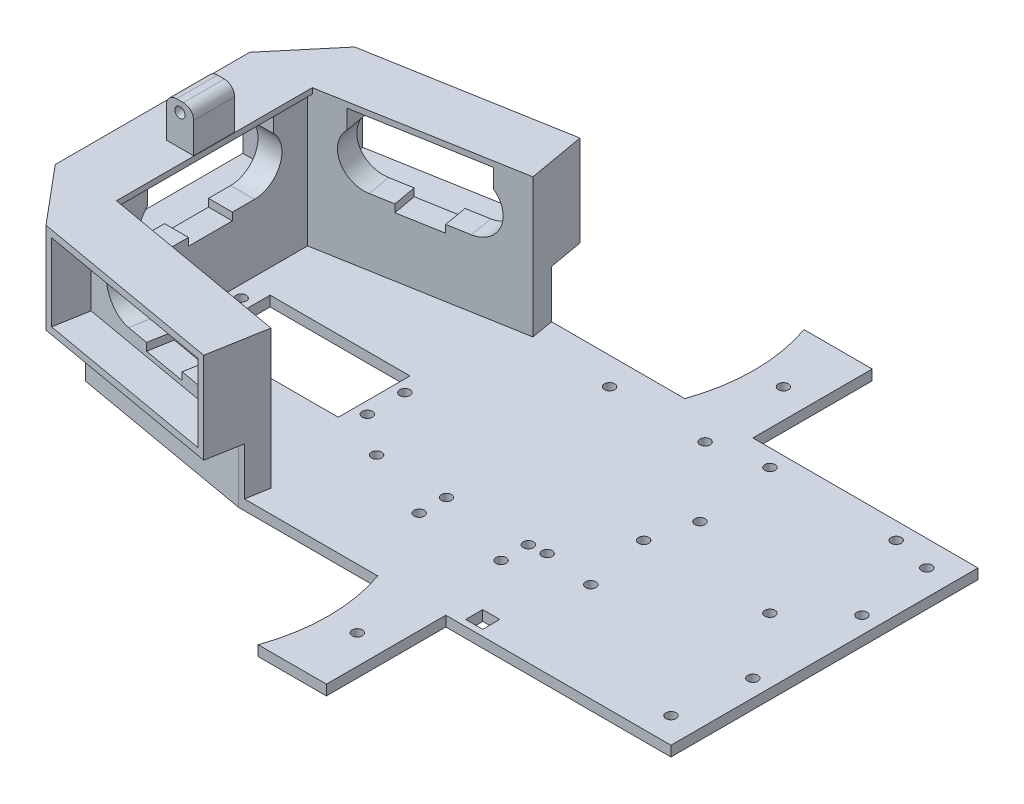
from build123d import *

# Parameters (mm, degrees)
CUT_EXTRUDE1_START         = -17
CUT_EXTRUDE1_DEPTH         = 17
CUT_EXTRUDE1_2_OUTLINE_R   = 1.5
CUT_EXTRUDE1_2_OUTLINE_W   = 5
CUT_EXTRUDE1_2_OUTLINE_H   = 5
CUT_EXTRUDE1_2_DEPTH       = 3
CUT_EXTRUDE2_DEPTH         = 223.538615307
SKETCH3_W                  = 57.527059783
SKETCH3_H                  = 57
CUT_EXTRUDE3_DEPTH         = 14
SKETCH4_R                  = 1.5
SKETCH4_W                  = 41
SKETCH4_H                  = 21
CUT_EXTRUDE4_DEPTH         = 223.329564617
SKETCH5_R                  = 1.5
BOSS_EXTRUDE1_DEPTH        = 3
SKETCH6_R                  = 1.5
CUT_EXTRUDE5_DEPTH         = 223.329564617
BOSS_EXTRUDE2_START        = 57.765161545
BOSS_EXTRUDE2_DEPTH        = 5.62
BOSS_EXTRUDE2_START_2      = 77.265161545
BOSS_EXTRUDE2_2_DEPTH      = 5.5
BOSS_EXTRUDE2_START_3      = 82.765161545
BOSS_EXTRUDE2_3_DEPTH      = 1.651
BOSS_EXTRUDE2_4_OUTLINE_W  = 7
BOSS_EXTRUDE2_4_OUTLINE_H  = 12.86
BOSS_EXTRUDE2_4_DEPTH      = 3.38
BOSS_EXTRUDE2_START_4      = 84.416161545
BOSS_EXTRUDE2_5_OUTLINE_W  = 8
BOSS_EXTRUDE2_5_OUTLINE_H  = 12
BOSS_EXTRUDE2_5_DEPTH      = 7.4999999
BOSS_EXTRUDE2_6_OUTLINE_W  = 1.082567319
BOSS_EXTRUDE2_6_OUTLINE_H  = 12
BOSS_EXTRUDE2_6_DEPTH      = 9
BOSS_EXTRUDE2_START_5      = 63.385161545
BOSS_EXTRUDE2_7_DEPTH      = 13.88
BOSS_EXTRUDE2_START_6      = 91.916161445
BOSS_EXTRUDE2_8_OUTLINE_W  = 6.917432681
BOSS_EXTRUDE2_8_OUTLINE_H  = 12
BOSS_EXTRUDE2_8_DEPTH      = 4.5000001
BOSS_EXTRUDE2_START_7      = 83.47948579
BOSS_EXTRUDE2_9_DEPTH      = 12
BOSS_EXTRUDE2_START_8      = -43.782894879
BOSS_EXTRUDE2_10_DEPTH     = 7
BOSS_EXTRUDE2_START_9      = -129.574394967
BOSS_EXTRUDE2_11_DEPTH     = 6.999999999
BOSS_EXTRUDE2_START_10     = 46.665787715
BOSS_EXTRUDE2_12_DEPTH     = 7
BOSS_EXTRUDE2_13_OUTLINE_R = 1.5
BOSS_EXTRUDE2_13_DEPTH     = 12
SKETCH8_W                  = 53
SKETCH8_H                  = 22.651
CUT_EXTRUDE6_DEPTH         = 10
SKETCH10_W                 = 57
SKETCH10_H                 = 26.651
BOSS_EXTRUDE3_DEPTH        = 10
SKETCH11_W                 = 57
SKETCH11_H                 = 26.651
BOSS_EXTRUDE4_DEPTH        = 10
SKETCH12_W                 = 53
SKETCH12_H                 = 22.651
CUT_EXTRUDE7_DEPTH         = 10
SKETCH13_W                 = 53
SKETCH13_H                 = 22.651
CUT_EXTRUDE8_DEPTH         = 10
BOSS_EXTRUDE5_DEPTH        = 1.651
BOSS_EXTRUDE6_DEPTH        = 1.651
BOSS_EXTRUDE7_DEPTH        = 26.5
CUT_EXTRUDE9_DEPTH         = 14


with BuildPart() as part:
    # Cut-Extrude1: read off the stored shape, not the designer's step
    # Cut-Extrude1 outline → Cut-Extrude1 (new body)
    with BuildSketch(Plane(origin=(0, 57.765161545, 0), x_dir=(1, 0, 0), z_dir=(0, 1, 0)).offset(CUT_EXTRUDE1_START)):
        Polygon((16.481861762, -134.47948579), (20.744164904, -134.47948579), (20.744164904, -44.47948579), (16.481861762, -44.47948579), (-37.998432123, -54.085831519), (-38.204871184, -53.901462095), (-48.782894879, -64.47948579), (-48.782894879, -114.47948579), (-38.193836366, -125.068544303), (-37.998432123, -124.873140061), align=None)
    extrude(amount=CUT_EXTRUDE1_DEPTH)

    # Cut-Extrude1 2 outline → Cut-Extrude1 2 (add)
    with BuildSketch(Plane(origin=(0, 57.765161545, 0), x_dir=(1, 0, 0), z_dir=(0, 1, 0)).offset(CUT_EXTRUDE1_START)):
        with BuildLine():
            Line((77.217105121, -134.47948579), (143.217105121, -134.47948579))
            Line((143.217105121, -134.47948579), (143.217105121, -44.47948579))
            Line((143.217105121, -44.47948579), (77.217105121, -44.47948579))
            Line((77.217105121, -44.47948579), (77.217105121, -9.47948579))
            Line((77.217105121, -9.47948579), (57.217105121, -9.47948579))
            ThreePointArc((57.217105121, -9.47948579), (60.217105121, -27.041970806), (57.217105121, -44.604455822))
            Line((57.217105121, -44.604455822), (57.217105121, -44.47948579))
            Line((57.217105121, -44.47948579), (20.744164904, -44.47948579))
            Line((20.744164904, -44.47948579), (20.744164904, -134.47948579))
            Line((20.744164904, -134.47948579), (57.217105121, -134.47948579))
            Line((57.217105121, -134.47948579), (57.217105121, -134.354515758))
            ThreePointArc((57.217105121, -134.354515758), (60.217105121, -151.917000774), (57.217105121, -169.47948579))
            Line((57.217105121, -169.47948579), (77.217105121, -169.47948579))
            Line((77.217105121, -169.47948579), (77.217105121, -134.47948579))
        make_face()
        with Locations((26.417105121, -103.97948579)):
            Circle(CUT_EXTRUDE1_2_OUTLINE_R, mode=Mode.SUBTRACT)
        with Locations((68.717105121, -151.948243282)):
            Circle(CUT_EXTRUDE1_2_OUTLINE_R, mode=Mode.SUBTRACT)
        with Locations((83.701551208, -130.140887009)):
            Rectangle(CUT_EXTRUDE1_2_OUTLINE_W, CUT_EXTRUDE1_2_OUTLINE_H, mode=Mode.SUBTRACT)
        with Locations((53.717105121, -96.47948579)):
            Circle(CUT_EXTRUDE1_2_OUTLINE_R, mode=Mode.SUBTRACT)
        with Locations((76.417105121, -103.97948579)):
            Circle(CUT_EXTRUDE1_2_OUTLINE_R, mode=Mode.SUBTRACT)
        with Locations((90.717105121, -105.47948579)):
            Circle(CUT_EXTRUDE1_2_OUTLINE_R, mode=Mode.SUBTRACT)
        with Locations((135.717105121, -126.97948579)):
            Circle(CUT_EXTRUDE1_2_OUTLINE_R, mode=Mode.SUBTRACT)
        with Locations((138.217105121, -105.47948579)):
            Circle(CUT_EXTRUDE1_2_OUTLINE_R, mode=Mode.SUBTRACT)
        with Locations((43.217105121, -52.47948579)):
            Circle(CUT_EXTRUDE1_2_OUTLINE_R, mode=Mode.SUBTRACT)
        with Locations((53.717105121, -78.47948579)):
            Circle(CUT_EXTRUDE1_2_OUTLINE_R, mode=Mode.SUBTRACT)
        with Locations((87.217105121, -86.47948579)):
            Circle(CUT_EXTRUDE1_2_OUTLINE_R, mode=Mode.SUBTRACT)
        with Locations((90.717105121, -73.47948579)):
            Circle(CUT_EXTRUDE1_2_OUTLINE_R, mode=Mode.SUBTRACT)
        with Locations((71.217105121, -52.47948579)):
            Circle(CUT_EXTRUDE1_2_OUTLINE_R, mode=Mode.SUBTRACT)
        with Locations((124.217105121, -86.47948579)):
            Circle(CUT_EXTRUDE1_2_OUTLINE_R, mode=Mode.SUBTRACT)
        with Locations((138.217105121, -73.47948579)):
            Circle(CUT_EXTRUDE1_2_OUTLINE_R, mode=Mode.SUBTRACT)
        with Locations((135.717105121, -51.97948579)):
            Circle(CUT_EXTRUDE1_2_OUTLINE_R, mode=Mode.SUBTRACT)
        with Locations((87.217105121, -49.47948579)):
            Circle(CUT_EXTRUDE1_2_OUTLINE_R, mode=Mode.SUBTRACT)
        with Locations((68.717105121, -27.010728298)):
            Circle(CUT_EXTRUDE1_2_OUTLINE_R, mode=Mode.SUBTRACT)
        with Locations((124.217105121, -49.47948579)):
            Circle(CUT_EXTRUDE1_2_OUTLINE_R, mode=Mode.SUBTRACT)
    extrude(amount=CUT_EXTRUDE1_2_DEPTH)

    # Sketch2 → Cut-Extrude2 (cut, through all)
    with BuildSketch(Plane(origin=(0, 57.765161545, 0), x_dir=(1, 0, 0), z_dir=(0, 1, 0))):
        Polygon((-37.998432123, -54.085831519), (-38.204871184, -53.901462095), (-48.782894879, -64.47948579), (-48.782894879, -66.938253753), (-43.782894879, -60.97948579), align=None)
        Polygon((-37.998432123, -124.873140061), (-43.782894879, -117.97948579), (-48.782894879, -112.020717827), (-48.782894879, -114.47948579), (-38.193836366, -125.068544303), align=None)
    extrude(amount=-CUT_EXTRUDE2_DEPTH, mode=Mode.SUBTRACT)

    # Sketch3 → Cut-Extrude3 (cut)
    with BuildSketch(Plane(origin=(0, 57.765161545, 0), x_dir=(1, 0, 0), z_dir=(0, 1, 0))):
        with Locations((-8.019364988, -89.47948579)):
            Rectangle(SKETCH3_W, SKETCH3_H)
    extrude(amount=-CUT_EXTRUDE3_DEPTH, mode=Mode.SUBTRACT)

    # Sketch4 → Cut-Extrude4 (cut, through all)
    with BuildSketch(Plane(origin=(0, 43.765161545, 0), x_dir=(1, 0, 0), z_dir=(0, 1, 0))):
        with Locations(Location((-33.282894879, -83.97948579, 0), (0, 0, 270))):
            Circle(SKETCH4_R)
        with Locations(Location((-33.282894879, -94.97948579, 0), (0, 0, 270))):
            Circle(SKETCH4_R)
        with Locations(Location((14.717105121, -83.97948579, 0), (0, 0, 270))):
            Circle(SKETCH4_R)
        with Locations(Location((14.717105121, -94.97948579, 0), (0, 0, 270))):
            Circle(SKETCH4_R)
        with Locations((-9.282894879, -89.47948579)):
            Rectangle(SKETCH4_W, SKETCH4_H)
    extrude(amount=-CUT_EXTRUDE4_DEPTH, mode=Mode.SUBTRACT)

    # Sketch5 → Boss-Extrude1 (add, through all)
    with BuildSketch(Plane(origin=(0, 43.765161545, 0), x_dir=(1, 0, 0), z_dir=(0, 1, 0))):
        with Locations((53.717105121, -78.47948579)):
            Circle(SKETCH5_R)
        with Locations((53.717105121, -96.47948579)):
            Circle(SKETCH5_R)
    extrude(amount=-BOSS_EXTRUDE1_DEPTH)

    # Sketch6 → Cut-Extrude5 (cut, through all)
    with BuildSketch(Plane(origin=(0, 43.765161545, 0), x_dir=(1, 0, 0), z_dir=(0, 1, 0))):
        with Locations(Location((47.417105121, -112.47948579, 0), (0, 0, 270))):
            Circle(SKETCH6_R)
        with Locations(Location((47.417105121, -104.47948579, 0), (0, 0, 270))):
            Circle(SKETCH6_R)
        with Locations(Location((71.417105121, -104.47948579, 0), (0, 0, 270))):
            Circle(SKETCH6_R)
        with Locations(Location((71.417105121, -112.47948579, 0), (0, 0, 270))):
            Circle(SKETCH6_R)
    extrude(amount=-CUT_EXTRUDE5_DEPTH, mode=Mode.SUBTRACT)

    # Boss-Extrude2: read off the stored shape, not the designer's step
    # Boss-Extrude2 outline → Boss-Extrude2 (add)
    with BuildSketch(Plane(origin=(0, 0, 0), x_dir=(1, 0, 0), z_dir=(0, 1, 0)).offset(BOSS_EXTRUDE2_START)):
        Polygon((-43.782894879, -117.97948579), (-37.998432123, -124.873140061), (-39.7349139, -134.721217591), (16.399128022, -144.619163718), (19.351147042, -127.877431917), (-2.383560067, -124.045016636), (-3.59909731, -130.938670907), (-16.263725014, -128.705555342), (-15.04818777, -121.811901071), (-36.782894879, -117.97948579), (-36.782894879, -95.90948579), (-43.782894879, -95.90948579), align=None)
        Polygon((-43.782894879, -83.04948579), (-36.782894879, -83.04948579), (-36.782894879, -60.97948579), (-15.04818777, -57.147070509), (-16.263725014, -50.253416238), (-37.998432123, -54.085831519), (-43.782894879, -60.97948579), align=None)
        Polygon((-3.59909731, -48.020300673), (-2.383560067, -54.913954944), (19.351147042, -51.081539663), (18.135609799, -44.187885392), align=None)
    extrude(amount=BOSS_EXTRUDE2_DEPTH)

    # Boss-Extrude2 4 outline → Boss-Extrude2 4 (add)
    with BuildSketch(Plane(origin=(0, 0, 0), x_dir=(1, 0, 0), z_dir=(0, 1, 0)).offset(BOSS_EXTRUDE2_START)):
        with Locations((-40.282894879, -89.47948579)):
            Rectangle(BOSS_EXTRUDE2_4_OUTLINE_W, BOSS_EXTRUDE2_4_OUTLINE_H)
        Polygon((-16.263725014, -128.705555342), (-3.59909731, -130.938670907), (-2.383560067, -124.045016636), (-15.04818777, -121.811901071), align=None)
        Polygon((-16.263725014, -50.253416238), (-15.04818777, -57.147070509), (-2.383560067, -54.913954944), (-3.59909731, -48.020300673), align=None)
    extrude(amount=BOSS_EXTRUDE2_4_DEPTH)



with BuildPart() as body_2:
    # Boss-Extrude2 2 outline → Boss-Extrude2 2 (new body)
    with BuildSketch(Plane(origin=(0, 0, 0), x_dir=(1, 0, 0), z_dir=(0, 1, 0)).offset(BOSS_EXTRUDE2_START_2)):
        Polygon((-43.782894879, -117.97948579), (-37.998432123, -124.873140061), (-39.7349139, -134.721217591), (16.399128022, -144.619163718), (19.351147042, -127.877431917), (9.503069512, -126.14095014), (8.287532269, -133.034604411), (-28.150354593, -126.609621838), (-26.934817349, -119.715967566), (-36.782894879, -117.97948579), (-36.782894879, -107.97948579), (-43.782894879, -107.97948579), align=None)
        Polygon((-43.782894879, -60.97948579), (-43.782894879, -70.97948579), (-36.782894879, -70.97948579), (-36.782894879, -60.97948579), (-26.934817349, -59.243004013), (-28.150354593, -52.349349742), (-37.998432123, -54.085831519), align=None)
        Polygon((8.287532269, -45.924367168), (9.503069512, -52.818021439), (19.351147042, -51.081539663), (18.135609799, -44.187885392), align=None)
    extrude(amount=BOSS_EXTRUDE2_2_DEPTH)

    # Boss-Extrude2 3 outline → Boss-Extrude2 3 (add)
    with BuildSketch(Plane(origin=(0, 0, 0), x_dir=(1, 0, 0), z_dir=(0, 1, 0)).offset(BOSS_EXTRUDE2_START_3)):
        Polygon((-43.782894879, -117.97948579), (-37.998432123, -124.873140061), (-39.7349139, -134.721217591), (16.399128022, -144.619163718), (18.135609798, -134.771086188), (-35.61776024, -125.292916746), (-35.61776024, -53.666054834), (-37.998432123, -54.085831519), (-43.782894879, -60.97948579), align=None)
    extrude(amount=BOSS_EXTRUDE2_3_DEPTH)

    # Boss-Extrude2 5 outline → Boss-Extrude2 5 (add)
    with BuildSketch(Plane(origin=(0, 0, 0), x_dir=(1, 0, 0), z_dir=(0, 1, 0)).offset(BOSS_EXTRUDE2_START_4)):
        with Locations((-39.70032756, -89.47948579)):
            Rectangle(BOSS_EXTRUDE2_5_OUTLINE_W, BOSS_EXTRUDE2_5_OUTLINE_H)
    extrude(amount=BOSS_EXTRUDE2_5_DEPTH)

    # Boss-Extrude2 6 outline → Boss-Extrude2 6 (add)
    with BuildSketch(Plane(origin=(0, 0, 0), x_dir=(1, 0, 0), z_dir=(0, 1, 0)).offset(BOSS_EXTRUDE2_START_4)):
        with Locations((-36.24161122, -89.47948579)):
            Rectangle(BOSS_EXTRUDE2_6_OUTLINE_W, BOSS_EXTRUDE2_6_OUTLINE_H)
    extrude(amount=BOSS_EXTRUDE2_6_DEPTH)


with BuildPart() as part_1:
    add(part.part)

    add(body_2.part)  # Boss-Extrude2 7 merges body 2
    # Boss-Extrude2 7 outline → Boss-Extrude2 7 (add)
    with BuildSketch(Plane(origin=(0, 0, 0), x_dir=(1, 0, 0), z_dir=(0, 1, 0)).offset(BOSS_EXTRUDE2_START_5)):
        Polygon((-43.782894879, -117.97948579), (-37.998432123, -124.873140061), (-39.7349139, -134.721217591), (16.399128022, -144.619163718), (18.135609798, -134.771086188), (19.351147042, -127.877431917), (-36.782894879, -117.97948579), (-36.782894879, -95.47948579), (-43.70032756, -95.47948579), (-43.70032756, -83.47948579), (-36.782894879, -83.47948579), (-36.782894879, -60.97948579), (19.351147042, -51.081539663), (18.135609799, -44.187885392), (-37.998432123, -54.085831519), (-43.782894879, -60.97948579), align=None)
    extrude(amount=BOSS_EXTRUDE2_7_DEPTH)

    # Boss-Extrude2 8 outline → Boss-Extrude2 8 (add)
    with BuildSketch(Plane(origin=(0, 0, 0), x_dir=(1, 0, 0), z_dir=(0, 1, 0)).offset(BOSS_EXTRUDE2_START_6)):
        with Locations((-40.24161122, -89.47948579)):
            Rectangle(BOSS_EXTRUDE2_8_OUTLINE_W, BOSS_EXTRUDE2_8_OUTLINE_H)
    extrude(amount=BOSS_EXTRUDE2_8_DEPTH)

    # Boss-Extrude2 9 outline → Boss-Extrude2 9 (add)
    with BuildSketch(Plane.XY.offset(BOSS_EXTRUDE2_START_7)):
        with BuildLine():
            ThreePointArc((-35.70032756, 93.416161545), (-35.984420893, 94.690465661), (-36.782894879, 95.723422241))
            Line((-36.782894879, 95.723422241), (-36.782894879, 93.416161545))
            Line((-36.782894879, 93.416161545), (-35.70032756, 93.416161545))
        make_face()
    extrude(amount=BOSS_EXTRUDE2_9_DEPTH)

    # Boss-Extrude2 10 outline → Boss-Extrude2 10 (cut)
    with BuildSketch(Plane.YZ.offset(BOSS_EXTRUDE2_START_8)):
        with BuildLine():
            Line((77.265161545, 70.97948579), (77.265161545, 107.97948579))
            ThreePointArc((77.265161545, 107.97948579), (68.450646523, 109.865629149), (63.385161545, 102.40948579))
            Line((63.385161545, 102.40948579), (63.385161545, 76.54948579))
            ThreePointArc((63.385161545, 76.54948579), (68.449601307, 69.090737836), (77.265161545, 70.97948579))
        make_face()
    extrude(amount=BOSS_EXTRUDE2_10_DEPTH, mode=Mode.SUBTRACT)

    # Boss-Extrude2 11 outline → Boss-Extrude2 11 (cut)
    with BuildSketch(Plane(origin=(0, 0, 0), x_dir=(0.9848077530122075, 0, 0.17364817766693394), z_dir=(0.1736481776669339, 0, -0.9848077530122076)).offset(BOSS_EXTRUDE2_START_9)):
        with BuildLine():
            Line((25.692842654, -63.385161545), (-0.167157346, -63.385161545))
            ThreePointArc((-0.167157346, -63.385161545), (-7.6259053, -68.449601307), (-5.737157346, -77.265161545))
            Line((-5.737157346, -77.265161545), (31.262842654, -77.265161545))
            ThreePointArc((31.262842654, -77.265161545), (33.148986014, -68.450646522), (25.692842654, -63.385161545))
        make_face()
    extrude(amount=BOSS_EXTRUDE2_11_DEPTH, mode=Mode.SUBTRACT)

    # Boss-Extrude2 12 outline → Boss-Extrude2 12 (cut)
    with BuildSketch(Plane(origin=(0, 0, 0), x_dir=(0.9848077530122072, 0, -0.17364817766693502), z_dir=(0.17364817766693502, 0, 0.9848077530122072)).offset(BOSS_EXTRUDE2_START_10)):
        with BuildLine():
            Line((-31.243056638, 63.385161545), (-5.383056638, 63.385161545))
            ThreePointArc((-5.383056638, 63.385161545), (2.075691316, 68.449601307), (0.186943362, 77.265161545))
            Line((0.186943362, 77.265161545), (-36.813056638, 77.265161545))
            ThreePointArc((-36.813056638, 77.265161545), (-38.699199997, 68.450646523), (-31.243056638, 63.385161545))
        make_face()
    extrude(amount=BOSS_EXTRUDE2_12_DEPTH, mode=Mode.SUBTRACT)

    # Boss-Extrude2 13 outline → Boss-Extrude2 13 (cut)
    with BuildSketch(Plane.XY.offset(BOSS_EXTRUDE2_START_7)):
        with Locations((-39.70032756, 93.416161545)):
            Circle(BOSS_EXTRUDE2_13_OUTLINE_R)
        with BuildLine():
            Line((-36.782894879, 96.416161545), (-38.70032756, 96.416161545))
            ThreePointArc((-38.70032756, 96.416161545), (-37.68096062, 96.237666648), (-36.782894879, 95.723422241))
            Line((-36.782894879, 95.723422241), (-36.782894879, 96.416161545))
        make_face()
        with BuildLine():
            ThreePointArc((-43.70032756, 93.416161545), (-42.821647904, 95.537481888), (-40.70032756, 96.416161545))
            Line((-40.70032756, 96.416161545), (-43.70032756, 96.416161545))
            Line((-43.70032756, 96.416161545), (-43.70032756, 93.416161545))
        make_face()
    extrude(amount=BOSS_EXTRUDE2_13_DEPTH, mode=Mode.SUBTRACT)

    # Sketch8 → Cut-Extrude6 (cut)
    with BuildSketch(Plane(origin=(-24.236839335, 0, 137.453946286), x_dir=(0.9848077530122076, 0, 0.17364817766693322), z_dir=(-0.17364817766693322, 0, 0.9848077530122076))):
        with Locations((12.762842654, 71.090661545)):
            Rectangle(SKETCH8_W, SKETCH8_H)
    extrude(amount=-CUT_EXTRUDE6_DEPTH, mode=Mode.SUBTRACT)

    # Sketch10 → Boss-Extrude3 (add)
    with BuildSketch(Plane.ZY.offset(43.782894879)):
        with Locations((89.47948579, 71.090661545)):
            Rectangle(SKETCH10_W, SKETCH10_H)
    extrude(amount=BOSS_EXTRUDE3_DEPTH)

    # Sketch11 → Boss-Extrude4 (add)
    with BuildSketch(Plane(origin=(8.103428996, 0, 45.956829542), x_dir=(-0.9848077530122076, 0, 0.1736481776669334), z_dir=(-0.17364817766693344, 0, -0.9848077530122077))):
        with Locations((18.313056638, 71.090661545)):
            Rectangle(SKETCH11_W, SKETCH11_H)
    extrude(amount=BOSS_EXTRUDE4_DEPTH)

    # Sketch12 → Cut-Extrude7 (cut)
    with BuildSketch(Plane(origin=(6.366947219, 0, 36.108752012), x_dir=(-0.9848077530122076, 0, 0.17364817766693338), z_dir=(-0.1736481776669334, 0, -0.9848077530122077))):
        with Locations((18.313056638, 71.090661545)):
            Rectangle(SKETCH12_W, SKETCH12_H)
    extrude(amount=-CUT_EXTRUDE7_DEPTH, mode=Mode.SUBTRACT)

    # Sketch13 → Cut-Extrude8 (cut)
    with BuildSketch(Plane.ZY.offset(53.782894879)):
        with Locations((89.47948579, 71.090661545)):
            Rectangle(SKETCH13_W, SKETCH13_H)
    extrude(amount=-CUT_EXTRUDE8_DEPTH, mode=Mode.SUBTRACT)

    # Sketch14 → Boss-Extrude5 (add)
    with BuildSketch(Plane(origin=(0, 82.765161545, 0), x_dir=(1, 0, 0), z_dir=(0, 1, 0))):
        Polygon((19.351147042, -51.081539663), (-35.61776024, -60.774041117), (-35.61776024, -53.666054834), (18.135609799, -44.187885392), align=None)
    extrude(amount=BOSS_EXTRUDE5_DEPTH)

    # Sketch15 → Boss-Extrude6 (add)
    with BuildSketch(Plane(origin=(0, 82.765161545, 0), x_dir=(1, 0, 0), z_dir=(0, 1, 0))):
        Polygon((-35.61776024, -125.292916746), (-35.61776024, -118.184930463), (19.351147042, -127.877431917), (18.135609799, -134.771086188), align=None)
    extrude(amount=BOSS_EXTRUDE6_DEPTH)

    # Sketch16 → Boss-Extrude7 (add)
    with BuildSketch(Plane(origin=(0, 84.416161545, 0), x_dir=(1, 0, 0), z_dir=(0, 1, 0))):
        Polygon((-39.7349139, -134.721217591), (-37.998432123, -124.873140061), (-43.782894879, -117.97948579), (-53.782894879, -117.97948579), align=None)
        Polygon((-53.782894879, -60.97948579), (-43.782894879, -60.97948579), (-37.998432123, -54.085831519), (-39.7349139, -44.237753989), align=None)
    extrude(amount=-BOSS_EXTRUDE7_DEPTH)

    # Sketch17 → Cut-Extrude9 (cut)
    with BuildSketch(Plane(origin=(0, 57.765161545, 0), x_dir=(1, 0, 0), z_dir=(0, 1, 0))):
        Polygon((-36.782894879, -117.97948579), (19.351147042, -127.877431917), (18.187026817, -134.47948579), (20.744164904, -134.47948579), (20.744164904, -117.97948579), align=None)
        Polygon((-36.782894879, -60.97948579), (20.744164904, -60.97948579), (20.744164904, -44.47948579), (18.187026817, -44.47948579), (19.351147042, -51.081539663), align=None)
    extrude(amount=-CUT_EXTRUDE9_DEPTH, mode=Mode.SUBTRACT)


solid = part_1.part
